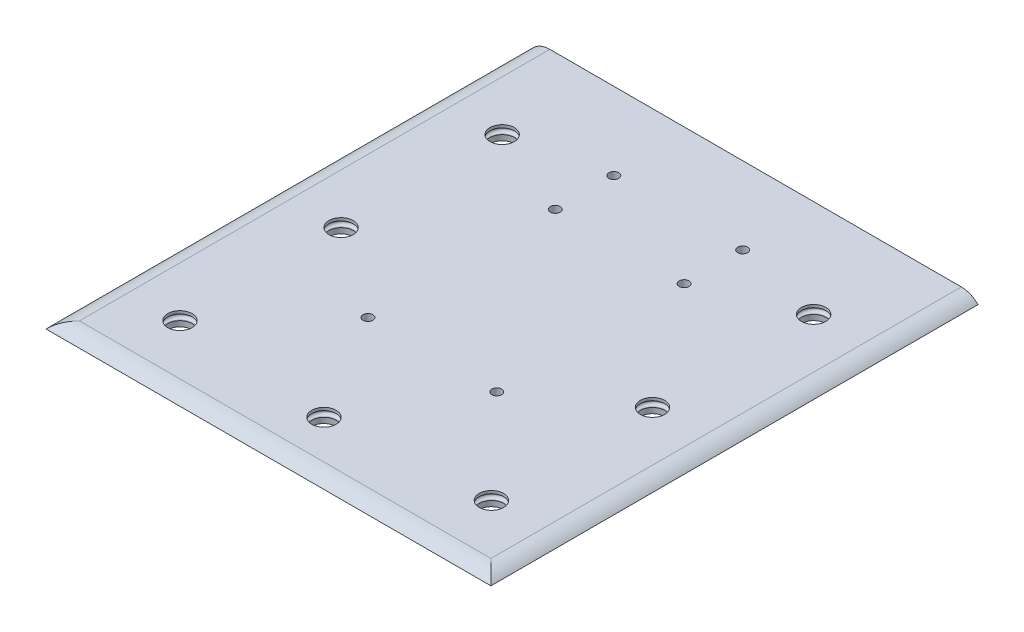
from build123d import *

# Parameters (mm, degrees)
SKETCH_1_W          = 190
SKETCH_1_H          = 208
EXTRUDE_1_DEPTH     = 3
FILLET_1_R          = 10
SKETCH_2_W          = 163
SKETCH_2_H          = 199.3
EXTRUDE_2_DEPTH     = 3
SKETCH_3_W          = 10
SKETCH_3_H          = 121.15
EXTRUDE_3_DEPTH     = 10
SKETCH_4_W          = 17.75
SKETCH_4_H          = 5
SKETCH_4_W_2        = 18
EXTRUDE_4_DEPTH     = 9
SKETCH_5_R          = 2.3
CUT_EXTRUDE_1_DEPTH = 9
SKETCH_6_R          = 2.3
CUT_EXTRUDE_2_DEPTH = 230
SKETCH_7_R          = 5.2
CUT_EXTRUDE_3_DEPTH = 10
CUT_EXTRUDE_START   = -1.2
SKETCH_8_R          = 6.7
CUT_EXTRUDE_4_DEPTH = 2.5
FILLET_2_R          = 1.2
SKETCH_11_R         = 2.1
CUT_EXTRUDE_5_DEPTH = 5


with BuildPart() as part:
    # Эскиз1 → Бобышка-Вытянуть1 (new body)
    with BuildSketch(Plane(origin=(0, 0, 0), x_dir=(1, 0, 0), z_dir=(0, 1, 0))):
        with Locations((95, 104)):
            Rectangle(SKETCH_1_W, SKETCH_1_H)
    extrude(amount=EXTRUDE_1_DEPTH)

    # Скругление1
    # the kernel refuses this fillet: 10 mm, written as the material it takes off along each edge
    with BuildSketch(Plane(origin=(190, 3, 17.853571071), x_dir=(0, -1, 0), z_dir=(0, 0, -1)), Plane(origin=(0, 3, -225.853571071), x_dir=(0, -1, 0), z_dir=(0, 0, 1))) as fillet_1_piece_1:
        with BuildLine():
            CenterArc((10, 7.141428429), FILLET_1_R, 180, 45.572995999)
            Line((0, 7.141428429), (-0.2, 7.141428429))
            Line((-0.2, 7.141428429), (-0.2, 0))
            Line((-0.2, 0), (0, -0.2))
            ThreePointArc((0, -0.2), (1.5, -0.2), (2.86, -0.142828569))
            Line((2.86, -0.142828569), (3, 0))
        make_face()
    extrude(amount=243.707142143, mode=Mode.SUBTRACT)
    with BuildSketch(Plane(origin=(-17.853571071, 3, 0), x_dir=(0, -1, 0), z_dir=(1, 0, 0))) as fillet_1_piece_2:
        with BuildLine():
            CenterArc((10, 7.141428429), FILLET_1_R, 180, 45.572995999)
            Line((0, 7.141428429), (-0.2, 7.141428429))
            Line((-0.2, 7.141428429), (-0.2, 0))
            Line((-0.2, 0), (0, -0.2))
            ThreePointArc((0, -0.2), (1.5, -0.2), (2.86, -0.142828569))
            Line((2.86, -0.142828569), (3, 0))
        make_face()
    extrude(amount=225.707142143, mode=Mode.SUBTRACT)

    # Эскиз2 → Бобышка-Вытянуть2 (add)
    with BuildSketch(Plane.XZ):
        with Locations((95, -108.35)):
            Rectangle(SKETCH_2_W, SKETCH_2_H)
    extrude(amount=EXTRUDE_2_DEPTH)

    # Эскиз3 → Бобышка-Вытянуть3 (add)
    with BuildSketch(Plane.XZ.offset(3)):
        with Locations((54.25, -147.425)):
            Rectangle(SKETCH_3_W, SKETCH_3_H)
        with Locations((135.75, -147.425)):
            Rectangle(SKETCH_3_W, SKETCH_3_H)
    extrude(amount=EXTRUDE_3_DEPTH)

    # Эскиз4 → Бобышка-Вытянуть4 (add)
    with BuildSketch(Plane.XZ.offset(3)):
        with Locations((34.375, -205.5)):
            Rectangle(SKETCH_4_W, SKETCH_4_H)
        with Locations((95, -205.5)):
            Rectangle(SKETCH_4_W_2, SKETCH_4_H)
        with Locations((155.625, -205.5)):
            Rectangle(SKETCH_4_W, SKETCH_4_H)
    extrude(amount=EXTRUDE_4_DEPTH)

    # Эскиз5 → Вырез-Вытянуть1 (cut)
    with BuildSketch(Plane(origin=(0, 0, -208), x_dir=(-1, 0, 0), z_dir=(0, 0, -1))):
        with Locations((-155.625, -8)):
            Circle(SKETCH_5_R)
        with Locations((-95, -8)):
            Circle(SKETCH_5_R)
        with Locations((-34.375, -8)):
            Circle(SKETCH_5_R)
    extrude(amount=-CUT_EXTRUDE_1_DEPTH, mode=Mode.SUBTRACT)

    # Эскиз6 → Вырез-Вытянуть2 (cut)
    with BuildSketch(Plane(origin=(140.75, 0, 0), x_dir=(0, 0, -1), z_dir=(1, 0, 0))):
        with Locations((101.85, -9)):
            Circle(SKETCH_6_R)
        with Locations((141.85, -9)):
            Circle(SKETCH_6_R)
    extrude(amount=-CUT_EXTRUDE_2_DEPTH, mode=Mode.SUBTRACT)

    # Эскиз7 → Вырез-Вытянуть3 (cut)
    with BuildSketch(Plane.XZ.offset(3)):
        with Locations(Location((95, -23.7, 0), (0, 0, 270))):
            Circle(SKETCH_7_R)
        with Locations(Location((28.5, -166.3, 0), (0, 0, 270))):
            Circle(SKETCH_7_R)
        with Locations(Location((28.5, -97.5, 0), (0, 0, 270))):
            Circle(SKETCH_7_R)
        with Locations(Location((28.5, -28.7, 0), (0, 0, 270))):
            Circle(SKETCH_7_R)
        with Locations(Location((161.5, -166.3, 0), (0, 0, 270))):
            Circle(SKETCH_7_R)
        with Locations(Location((161.5, -97.5, 0), (0, 0, 270))):
            Circle(SKETCH_7_R)
        with Locations(Location((161.5, -28.7, 0), (0, 0, 270))):
            Circle(SKETCH_7_R)
    extrude(amount=-CUT_EXTRUDE_3_DEPTH, mode=Mode.SUBTRACT)

    # Эскиз8 → Вырез-Вытянуть4 (cut)
    with BuildSketch(Plane(origin=(0, 3, 0), x_dir=(1, 0, 0), z_dir=(0, 1, 0)).offset(CUT_EXTRUDE_START)):
        with Locations(Location((28.5, 166.3, 0), (0, 0, 270))):
            Circle(SKETCH_8_R)
        with Locations(Location((28.5, 97.5, 0), (0, 0, 270))):
            Circle(SKETCH_8_R)
        with Locations(Location((28.5, 28.7, 0), (0, 0, 270))):
            Circle(SKETCH_8_R)
        with Locations(Location((95, 23.7, 0), (0, 0, 270))):
            Circle(SKETCH_8_R)
        with Locations(Location((161.5, 28.7, 0), (0, 0, 270))):
            Circle(SKETCH_8_R)
        with Locations(Location((161.5, 97.5, 0), (0, 0, 270))):
            Circle(SKETCH_8_R)
        with Locations(Location((161.5, 166.3, 0), (0, 0, 270))):
            Circle(SKETCH_8_R)
    extrude(amount=-CUT_EXTRUDE_4_DEPTH, mode=Mode.SUBTRACT)

    # Скругление2
    fillet_2_edges = [part.edges().sort_by_distance(p)[0] for p in [
        (28.5, 1.8, -104.2),
        (28.5, -0.7, -104.2),
        (28.5, 1.8, -35.4),
        (28.5, -0.7, -35.4),
        (95, 1.8, -30.4),
        (95, -0.7, -30.4),
        (161.5, 1.8, -35.4),
        (161.5, -0.7, -35.4),
        (161.5, 1.8, -104.2),
        (161.5, -0.7, -104.2),
        (161.5, 1.8, -173),
        (161.5, -0.7, -173),
        (28.5, 1.8, -173),
        (28.5, -0.7, -173),
    ]]
    fillet(fillet_2_edges, radius=FILLET_2_R)

    # Эскиз11 → Вырез-Вытянуть5 (cut)
    with BuildSketch(Plane(origin=(0, 3, 0), x_dir=(1, 0, 0), z_dir=(0, 1, 0))):
        with Locations(Location((67.5, 70, 0), (0, 0, 270))):
            Circle(SKETCH_11_R)
        with Locations(Location((122.5, 70, 0), (0, 0, 270))):
            Circle(SKETCH_11_R)
        with Locations(Location((122.5, 150, 0), (0, 0, 270))):
            Circle(SKETCH_11_R)
        with Locations(Location((122.5, 175, 0), (0, 0, 270))):
            Circle(SKETCH_11_R)
        with Locations(Location((67.5, 175, 0), (0, 0, 270))):
            Circle(SKETCH_11_R)
        with Locations(Location((67.5, 150, 0), (0, 0, 270))):
            Circle(SKETCH_11_R)
    extrude(amount=-CUT_EXTRUDE_5_DEPTH, mode=Mode.SUBTRACT)


solid = part.part
